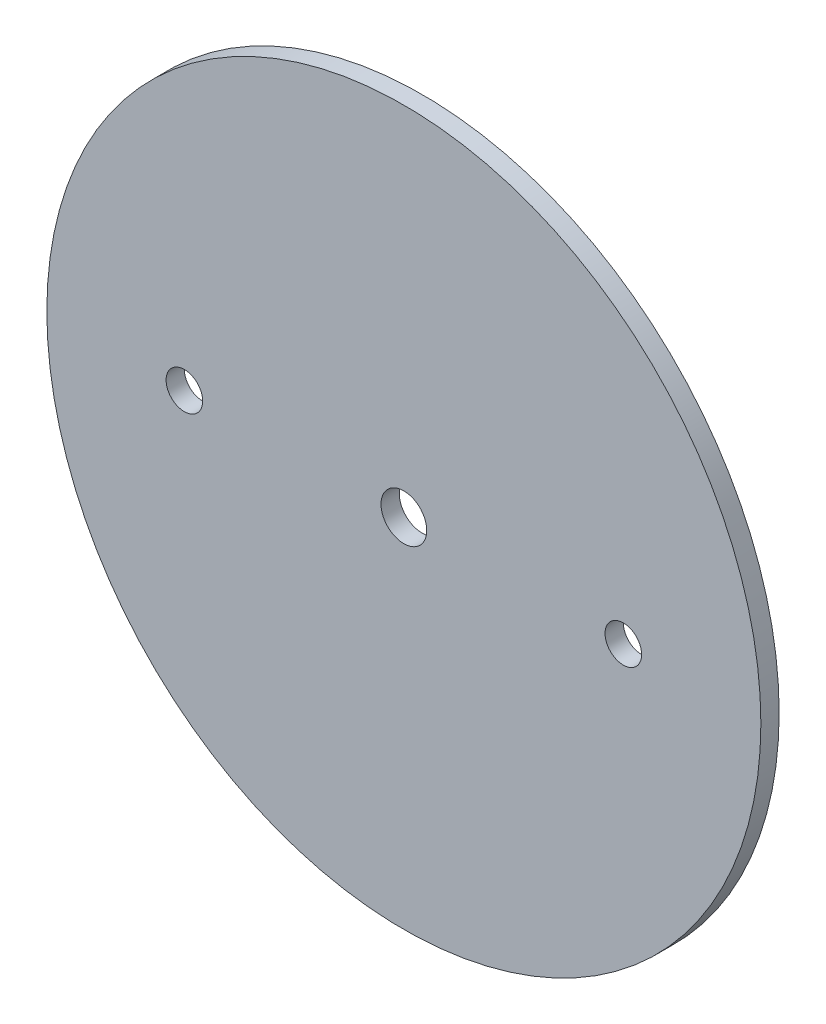
from build123d import *

# Parameters (mm, degrees)
SKETCH1_R                          = 61.976
BOSS_EXTRUDE1_DEPTH                = 1.5875
F_1_4_0_25_DIAMETER_HOLE1_D        = 6.35
F_5_16_0_3125_DIAMETER_HOLE1_D     = 7.9375
F_5_16_0_3125_DIAMETER_HOLE1_DEPTH = 3.302


with BuildPart() as part:
    # Sketch1 → Boss-Extrude1 (new, symmetric)
    with BuildSketch(Plane.XY):
        Circle(SKETCH1_R)
    extrude(amount=BOSS_EXTRUDE1_DEPTH, both=True)

    # 1/4 (0.25) Diameter Hole1 (through all)
    with Locations(Plane.XY.offset(1.5875)):
        with Locations((-38.1, 0), (38.1, 0)):
            Hole(F_1_4_0_25_DIAMETER_HOLE1_D / 2)

    # 5/16 (0.3125) Diameter Hole1
    with Locations(Plane.XY.offset(1.5875)):
        with Locations((0, 0)):
            Hole(F_5_16_0_3125_DIAMETER_HOLE1_D / 2, depth=F_5_16_0_3125_DIAMETER_HOLE1_DEPTH)


solid = part.part
